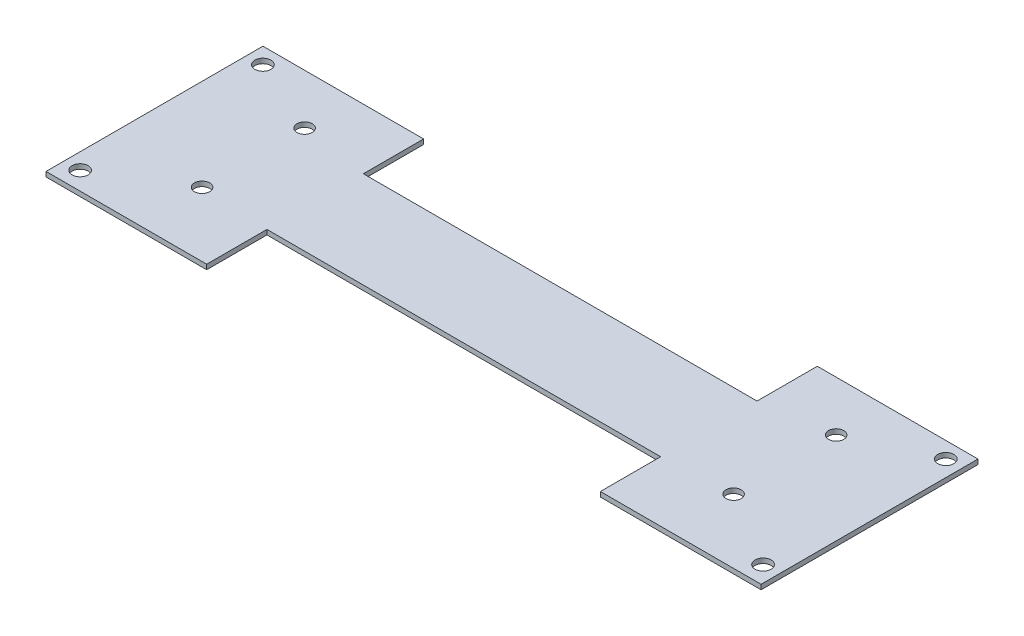
from build123d import *

# Parameters (mm, degrees)
SKETCH1_W          = 178
SKETCH1_H          = 54
BASE_FLANGE1_DEPTH = 1.2
SKETCH2_R          = 1.9
CUT_EXTRUDE1_DEPTH = 10
SKETCH3_W          = 98
SKETCH3_H          = 15
CUT_EXTRUDE2_DEPTH = 10
SKETCH4_R          = 2
CUT_EXTRUDE3_DEPTH = 10
SKETCH5_R          = 2
CUT_EXTRUDE4_DEPTH = 10


# Sheet-metal steps are written as plain solids
with BuildPart() as part:
    # Sketch1 → Base-Flange1 (new body)
    with BuildSketch(Plane(origin=(0, 0, 0), x_dir=(1, 0, 0), z_dir=(0, 1, 0))):
        with Locations((25.098152401, 5.183748797)):
            Rectangle(SKETCH1_W, SKETCH1_H)
    extrude(amount=-BASE_FLANGE1_DEPTH)

    # Sketch2 → Cut-Extrude1 (cut)
    with BuildSketch(Plane(origin=(0, 0, 0), x_dir=(1, 0, 0), z_dir=(0, 1, 0))):
        with Locations(Location((91.253152401, -5.816251203, 0), (0, 0, 270))):
            Circle(SKETCH2_R)
        with Locations(Location((-41.056847599, -5.816251203, 0), (0, 0, 270))):
            Circle(SKETCH2_R)
        with Locations(Location((91.253152401, 19.713748797, 0), (0, 0, 270))):
            Circle(SKETCH2_R)
        with Locations(Location((-41.056847599, 19.713748797, 0), (0, 0, 270))):
            Circle(SKETCH2_R)
    extrude(amount=-CUT_EXTRUDE1_DEPTH, mode=Mode.SUBTRACT)

    # Sketch3 → Cut-Extrude2 (cut)
    with BuildSketch(Plane(origin=(0, 0, 0), x_dir=(1, 0, 0), z_dir=(0, 1, 0))):
        with Locations((25.098152401, -14.316251203)):
            Rectangle(SKETCH3_W, SKETCH3_H)
        with Locations((25.098152401, 24.683748797)):
            Rectangle(SKETCH3_W, SKETCH3_H)
    extrude(amount=-CUT_EXTRUDE2_DEPTH, mode=Mode.SUBTRACT)

    # Sketch4 → Cut-Extrude3 (cut)
    with BuildSketch(Plane(origin=(0, 0, 0), x_dir=(1, 0, 0), z_dir=(0, 1, 0))):
        with Locations(Location((110.098152401, -17.316251203, 0), (0, 0, 270))):
            Circle(SKETCH4_R)
        with Locations(Location((110.098152401, 28.183748797, 0), (0, 0, 270))):
            Circle(SKETCH4_R)
    extrude(amount=-CUT_EXTRUDE3_DEPTH, mode=Mode.SUBTRACT)

    # Sketch5 → Cut-Extrude4 (cut)
    with BuildSketch(Plane(origin=(0, 0, 0), x_dir=(1, 0, 0), z_dir=(0, 1, 0))):
        with Locations(Location((-59.901847599, -17.316251203, 0), (0, 0, 270))):
            Circle(SKETCH5_R)
        with Locations(Location((-59.901847599, 28.183748797, 0), (0, 0, 270))):
            Circle(SKETCH5_R)
    extrude(amount=-CUT_EXTRUDE4_DEPTH, mode=Mode.SUBTRACT)


solid = part.part
